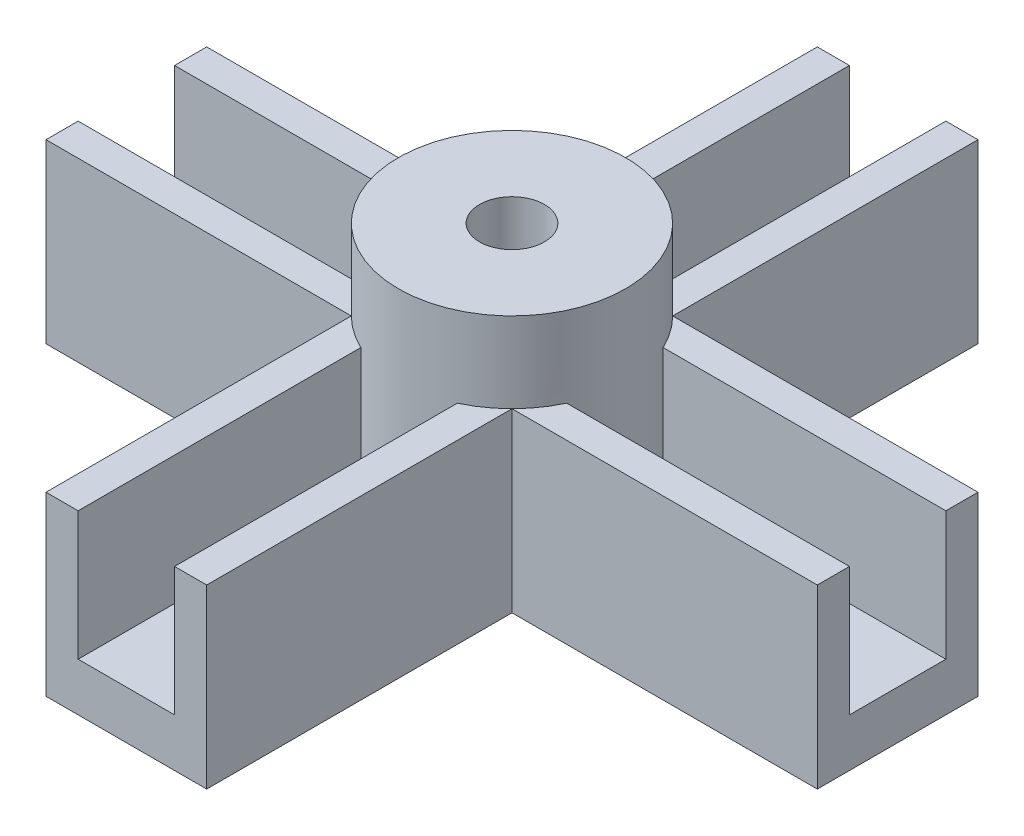
from build123d import *

# Parameters (mm, degrees)
BOSS_EXTRUDE1_DEPTH     = 7.5
BOSS_EXTRUDE1_2_DEPTH   = 7.5
BOSS_EXTRUDE1_3_DEPTH   = 7.5
BOSS_EXTRUDE1_4_DEPTH   = 7.5
SKETCH1_3_W             = 25
SKETCH1_3_H             = 25
SKETCH1_3_R             = 5.05
BOSS_EXTRUDE2_DEPTH     = 15
BOSS_EXTRUDE5_DEPTH     = 7.5
BOSS_EXTRUDE8_DEPTH     = 15
SKETCH1_8_R             = 17.67766953
BOSS_EXTRUDE9_DEPTH     = 40
BOSS_EXTRUDE10_DEPTH    = 20
CUT_EXTRUDE1_DEPTH      = 94.808315196
CUT_EXTRUDE1_DEPTH_BACK = 94.808315196
SKETCH1_9_R             = 5.05


# Read off the part's stored shape, not the designer's step: Boss-Extrude5
with BuildPart() as part:
    # Sketch1 → Boss-Extrude1 (new body)
    with BuildSketch(Plane(origin=(0, 0, 0), x_dir=(1, 0, 0), z_dir=(0, 1, 0))):
        with BuildLine():
            Line((-60, 12.5), (-60, -12.5))
            Line((-60, -12.5), (-12.5, -12.5))
            ThreePointArc((-12.5, -12.5), (-17.67766953, 0), (-12.5, 12.5))
            Line((-12.5, 12.5), (-60, 12.5))
        make_face()
    extrude(amount=BOSS_EXTRUDE1_DEPTH)



with BuildPart() as body_2:
    # Sketch1 → Boss-Extrude1 2 (new body)
    with BuildSketch(Plane(origin=(0, 0, 0), x_dir=(1, 0, 0), z_dir=(0, 1, 0))):
        with BuildLine():
            ThreePointArc((12.5, -12.5), (0, -17.67766953), (-12.5, -12.5))
            Line((-12.5, -12.5), (-12.5, -60))
            Line((-12.5, -60), (12.5, -60))
            Line((12.5, -60), (12.5, -12.5))
        make_face()
    extrude(amount=BOSS_EXTRUDE1_2_DEPTH)


with BuildPart() as body_3:
    # Sketch1 → Boss-Extrude1 3 (new body)
    with BuildSketch(Plane(origin=(0, 0, 0), x_dir=(1, 0, 0), z_dir=(0, 1, 0))):
        with BuildLine():
            ThreePointArc((12.5, 12.5), (17.67766953, 0), (12.5, -12.5))
            Line((12.5, -12.5), (60, -12.5))
            Line((60, -12.5), (60, 12.5))
            Line((60, 12.5), (12.5, 12.5))
        make_face()
    extrude(amount=BOSS_EXTRUDE1_3_DEPTH)


with BuildPart() as body_4:
    # Sketch1 → Boss-Extrude1 4 (new body)
    with BuildSketch(Plane(origin=(0, 0, 0), x_dir=(1, 0, 0), z_dir=(0, 1, 0))):
        with BuildLine():
            Line((-12.5, 60), (-12.5, 12.5))
            ThreePointArc((-12.5, 12.5), (0, 17.67766953), (12.5, 12.5))
            Line((12.5, 12.5), (12.5, 60))
            Line((12.5, 60), (-12.5, 60))
        make_face()
    extrude(amount=BOSS_EXTRUDE1_4_DEPTH)


with BuildPart() as body_5:
    # Sketch1<3> → Boss-Extrude2 (new body)
    with BuildSketch(Plane(origin=(0, 0, 0), x_dir=(1, 0, 0), z_dir=(0, 1, 0))):
        Rectangle(SKETCH1_3_W, SKETCH1_3_H)
        with Locations(Location((0, 0, 0), (0, 0, 270))):
            Circle(SKETCH1_3_R, mode=Mode.SUBTRACT)
    extrude(amount=BOSS_EXTRUDE2_DEPTH)


with BuildPart() as body_6:
    # Boss-Extrude5 outline → Boss-Extrude5 (new body)
    with BuildSketch(Plane(origin=(0, 0, 0), x_dir=(1, 0, 0), z_dir=(0, 1, 0))):
        with BuildLine():
            Line((-12.5, 60), (-12.5, 12.5))
            ThreePointArc((-12.5, 12.5), (0, 17.67766953), (12.5, 12.5))
            Line((12.5, 12.5), (12.5, 60))
            Line((12.5, 60), (-12.5, 60))
        make_face()
    extrude(amount=BOSS_EXTRUDE5_DEPTH)


with BuildPart() as part_1:
    add(part.part)

    add(body_2.part)  # Boss-Extrude8 merges body 2

    add(body_3.part)  # Boss-Extrude8 merges body 3

    add(body_4.part)  # Boss-Extrude8 merges body 4

    add(body_5.part)  # Boss-Extrude8 merges body 5

    add(body_6.part)  # Boss-Extrude8 merges body 6
    # Sketch1<7> → Boss-Extrude8 (add)
    with BuildSketch(Plane(origin=(0, 0, 0), x_dir=(1, 0, 0), z_dir=(0, 1, 0))):
        with BuildLine():
            ThreePointArc((-12.5, 12.5), (-17.67766953, 0), (-12.5, -12.5))
            Line((-12.5, -12.5), (-12.5, 12.5))
        make_face()
        with BuildLine():
            Line((12.5, -12.5), (-12.5, -12.5))
            ThreePointArc((-12.5, -12.5), (0, -17.67766953), (12.5, -12.5))
        make_face()
        with BuildLine():
            Line((12.5, 12.5), (12.5, -12.5))
            ThreePointArc((12.5, -12.5), (16.332037061, -6.764951252), (17.67766953, 0))
            ThreePointArc((17.67766953, 0), (16.332037061, 6.764951252), (12.5, 12.5))
        make_face()
        with BuildLine():
            ThreePointArc((12.5, 12.5), (0, 17.67766953), (-12.5, 12.5))
            Line((-12.5, 12.5), (12.5, 12.5))
        make_face()
    extrude(amount=BOSS_EXTRUDE8_DEPTH)

    # Sketch1<8> → Boss-Extrude9 (add)
    with BuildSketch(Plane(origin=(0, 0, 0), x_dir=(1, 0, 0), z_dir=(0, 1, 0))):
        with Locations(Location((0, 0, 0), (0, 0, 45))):
            Circle(SKETCH1_8_R)
    extrude(amount=BOSS_EXTRUDE9_DEPTH)

    # Sketch5 → Boss-Extrude10 (add)
    with BuildSketch(Plane(origin=(0, 7.5, 0), x_dir=(1, 0, 0), z_dir=(0, 1, 0))):
        with BuildLine():
            Line((-60, 7.5), (-16.007810594, 7.5))
            ThreePointArc((-16.007810594, 7.5), (-14.471482861, 10.152644177), (-12.5, 12.5))
            Line((-12.5, 12.5), (-60, 12.5))
            Line((-60, 12.5), (-60, 7.5))
        make_face()
        with BuildLine():
            Line((-12.5, 60), (-12.5, 12.5))
            ThreePointArc((-12.5, 12.5), (-10.152644177, 14.471482861), (-7.5, 16.007810594))
            Line((-7.5, 16.007810594), (-7.5, 60))
            Line((-7.5, 60), (-12.5, 60))
        make_face()
        with BuildLine():
            Line((7.5, 60), (7.5, 16.007810594))
            ThreePointArc((7.5, 16.007810594), (10.152644177, 14.471482861), (12.5, 12.5))
            Line((12.5, 12.5), (12.5, 60))
            Line((12.5, 60), (7.5, 60))
        make_face()
        with BuildLine():
            ThreePointArc((12.5, 12.5), (14.471482861, 10.152644177), (16.007810594, 7.5))
            Line((16.007810594, 7.5), (60, 7.5))
            Line((60, 7.5), (60, 12.5))
            Line((60, 12.5), (12.5, 12.5))
        make_face()
        with BuildLine():
            ThreePointArc((16.007810594, -7.5), (14.471482861, -10.152644177), (12.5, -12.5))
            Line((12.5, -12.5), (60, -12.5))
            Line((60, -12.5), (60, -7.5))
            Line((60, -7.5), (16.007810594, -7.5))
        make_face()
        with BuildLine():
            ThreePointArc((12.5, -12.5), (10.152644177, -14.471482861), (7.5, -16.007810594))
            Line((7.5, -16.007810594), (7.5, -60))
            Line((7.5, -60), (12.5, -60))
            Line((12.5, -60), (12.5, -12.5))
        make_face()
        with BuildLine():
            ThreePointArc((-7.5, -16.007810594), (-10.152644177, -14.471482861), (-12.5, -12.5))
            Line((-12.5, -12.5), (-12.5, -60))
            Line((-12.5, -60), (-7.5, -60))
            Line((-7.5, -60), (-7.5, -16.007810594))
        make_face()
        with BuildLine():
            Line((-60, -12.5), (-12.5, -12.5))
            ThreePointArc((-12.5, -12.5), (-14.471482861, -10.152644177), (-16.007810594, -7.5))
            Line((-16.007810594, -7.5), (-60, -7.5))
            Line((-60, -7.5), (-60, -12.5))
        make_face()
    extrude(amount=BOSS_EXTRUDE10_DEPTH)

    # Sketch1<9> → Cut-Extrude1 (cut, two sides: drawn at the far end of the back side and taken through both)
    with BuildSketch(Plane(origin=(0, 0, 0), x_dir=(1, 0, 0), z_dir=(0, 1, 0)).offset(-CUT_EXTRUDE1_DEPTH_BACK)):
        with Locations(Location((0, 0, 0), (0, 0, 270))):
            Circle(SKETCH1_9_R)
    extrude(amount=CUT_EXTRUDE1_DEPTH + CUT_EXTRUDE1_DEPTH_BACK, mode=Mode.SUBTRACT)


solid = part_1.part
